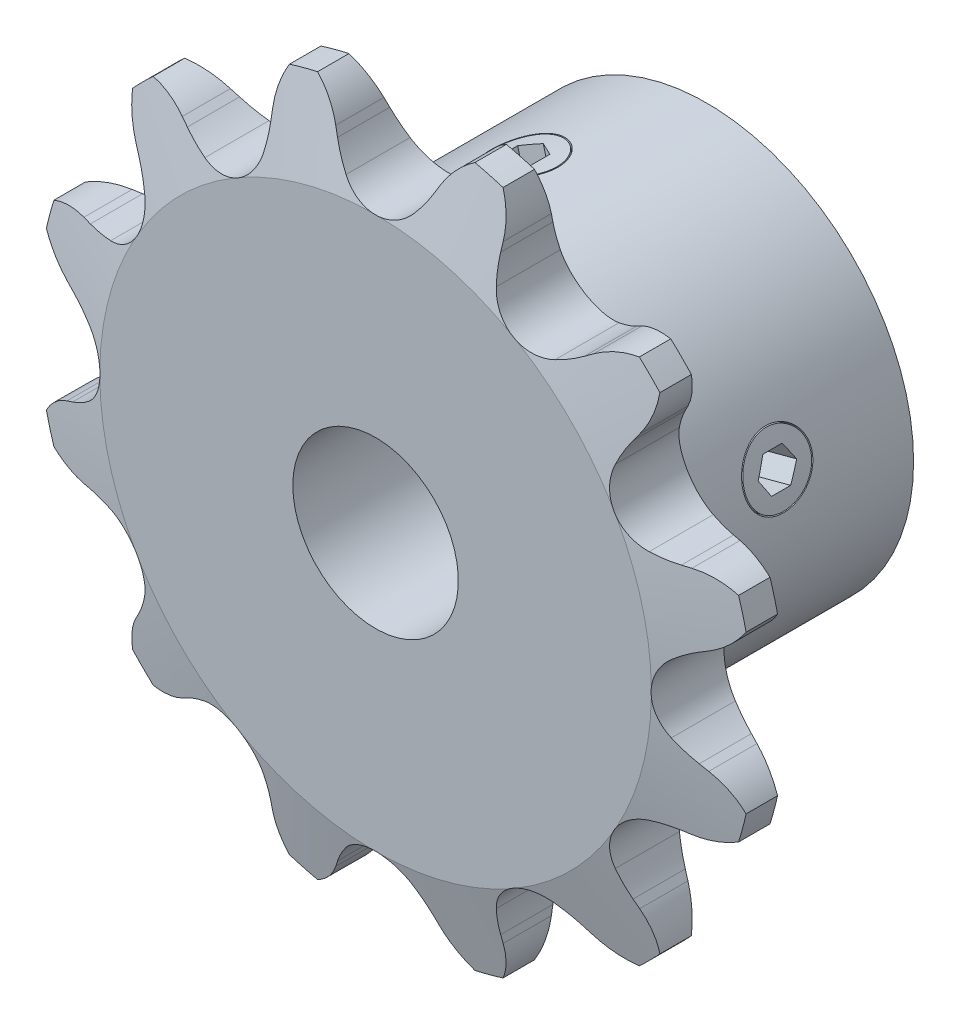
from build123d import *

# Parameters (mm, degrees)
TOOTH_CUT_NUMBER_OF_TEETH_12_DEPTH = 20.501564491
TOOTH_PATTERN_12_12_COUNT          = 12
SKETCH3_W                          = 9.906
SKETCH3_H                          = 7.9375
SKETCH4_R                          = 3.175
CUT_EXTRUDE1_DEPTH                 = 23.835008679
SKETCH7_R                          = 1.23825
CUT_EXTRUDE5_DEPTH                 = 25.456435746
CUT_EXTRUDE5_TAPER                 = -1
CUT_EXTRUDE5_OTHER_WAY_DEPTH       = 5.08
CUT_EXTRUDE5_OTHER_WAY_TAPER       = 1
EXTRUDE1_START                     = -5.08
EXTRUDE1_OUTLINE_R                 = 1.278474735
EXTRUDE1_DEPTH                     = 9.950685534
EXTRUDE1_START_2                   = -9
EXTRUDE1_2_DEPTH                   = 5
CUT_EXTRUDE6_START                 = 0.635
CUT_EXTRUDE6_DEPTH                 = 24.821435793
CIRPATTERN6_COUNT                  = 2
CIRPATTERN6_ANGLE                  = 90
SKETCH10_R                         = 3.175
CUT_EXTRUDE7_DEPTH                 = 23.835008679


with BuildPart() as part:
    # Sprocket-BaseSketch → 25 (04C) ANSI (ISO) Chain Number, 0.966in P.D. (revolve)
    with BuildSketch(Plane(origin=(0, 0, 0), x_dir=(0, 0, -1), z_dir=(1, 0, 0)), mode=Mode.PRIVATE) as f_25_04c_ansi_iso_chain_number_0_966i_sk:
        Polygon((1.397, 0), (1.397, 10.579261314), (0.60325, 13.754261314), (-0.60325, 13.754261314), (-1.397, 10.579261314), (-1.397, 0), align=None)
    revolve(f_25_04c_ansi_iso_chain_number_0_966i_sk.sketch.rotate(Axis((0, 0, -5.588), (0, 0, 1)), 90), axis=Axis((0, 0, -5.588), (0, 0, 1)))

    # Tooth-Sketch → Tooth-Cut, Number of teeth: 12 (cut, symmetric)
    with BuildSketch(Plane.XY):
        with BuildLine():
            Line((1.853848812, 12.017926297), (1.999985234, 12.308907838))
            ThreePointArc((1.999985234, 12.308907838), (3.017010036, 13.41879565), (4.46528191, 13.829525469))
            ThreePointArc((4.46528191, 13.829525469), (0, 14.532533063), (-4.46528191, 13.829525469))
            ThreePointArc((-4.46528191, 13.829525469), (-3.017010036, 13.41879565), (-1.999985234, 12.308907838))
            Line((-1.999985234, 12.308907838), (-1.853848812, 12.017926297))
            ThreePointArc((-1.853848812, 12.017926297), (-1.601561016, 11.580951016), (-1.300249366, 11.176219231))
            ThreePointArc((-1.300249366, 11.176219231), (0, 10.569902994), (1.300249366, 11.176219231))
            ThreePointArc((1.300249366, 11.176219231), (1.601561016, 11.580951016), (1.853848812, 12.017926297))
        make_face()
    tooth_cut_number_of_teeth_12 = extrude(amount=TOOTH_CUT_NUMBER_OF_TEETH_12_DEPTH, both=True, mode=Mode.SUBTRACT)

    # Tooth Pattern, 12 / 12: Tooth-Cut, Number of teeth: 12 ×12 about axis
    tooth_pattern_12_12_axis = Axis((0, 0, 0), (0, 0, 1))
    for i in range(1, TOOTH_PATTERN_12_12_COUNT):
        add(tooth_cut_number_of_teeth_12.rotate(tooth_pattern_12_12_axis, i * 360 / TOOTH_PATTERN_12_12_COUNT), mode=Mode.SUBTRACT)

    # Sketch3 → Hub-Revolve1 (revolve)
    with BuildSketch(Plane(origin=(0, 0, 0), x_dir=(0, 0, -1), z_dir=(1, 0, 0)), mode=Mode.PRIVATE) as hub_revolve1_sk:
        with Locations((6.35, 3.96875)):
            Rectangle(SKETCH3_W, SKETCH3_H)
    revolve(hub_revolve1_sk.sketch.rotate(Axis((0, 0, 9.906), (0, 0, -1)), 90), axis=Axis((0, 0, 9.906), (0, 0, -1)))

    # Sketch4 → Cut-Extrude1 (cut, through all)
    with BuildSketch(Plane(origin=(0, 0, -11.303), x_dir=(-1, 0, 0), z_dir=(0, 0, -1))):
        Circle(SKETCH4_R)
    extrude(amount=-CUT_EXTRUDE1_DEPTH, mode=Mode.SUBTRACT)

    # Sketch7 → Cut-Extrude5 (cut)
    with BuildSketch(Plane(origin=(-0.79375, 2.962315329, 0), x_dir=(-0.9659258262890682, -0.25881904510252124, 0), z_dir=(-0.25881904510252124, 0.9659258262890682, 0))):
        with Locations((0, -6.35)):
            Circle(SKETCH7_R)
    cut_extrude5 = extrude(amount=CUT_EXTRUDE5_DEPTH, taper=CUT_EXTRUDE5_TAPER, mode=Mode.SUBTRACT)

    # Sketch7 → Cut-Extrude5 other way (cut)
    with BuildSketch(Plane(origin=(-0.79375, 2.962315329, 0), x_dir=(-0.9659258262890682, -0.25881904510252124, 0), z_dir=(-0.25881904510252124, 0.9659258262890682, 0))):
        with Locations((0, -6.35)):
            Circle(SKETCH7_R)
    extrude(amount=-CUT_EXTRUDE5_OTHER_WAY_DEPTH, taper=CUT_EXTRUDE5_OTHER_WAY_TAPER, mode=Mode.SUBTRACT)

    # Extrude1: read off the stored shape, not the designer's step
    # Extrude1 outline → Extrude1 (add)
    with BuildSketch(Plane(origin=(-0.79375, 2.962315329, 0), x_dir=(-0.9659258262890682, -0.25881904510252124, 0), z_dir=(-0.25881904510252124, 0.9659258262890682, 0)).offset(EXTRUDE1_START)):
        with Locations((0, -6.35)):
            Circle(EXTRUDE1_OUTLINE_R)
    extrude1 = extrude(amount=EXTRUDE1_DEPTH)

    # Extrude1 2 outline → Extrude1 2 (cut)
    with BuildSketch(Plane.XY.offset(EXTRUDE1_START_2)):
        with BuildLine():
            ThreePointArc((-2.054376112, 7.667036262), (-1.428177703, 7.807958421), (-0.792640418, 7.89782422))
            Line((-0.792640418, 7.89782422), (0, 7.977375095))
            Line((0, 7.977375095), (0, 8.217504716))
            Line((0, 8.217504716), (-0.819464414, 7.997929888))
            Line((-0.819464414, 7.997929888), (-2.054376112, 7.667036262))
        make_face()
        with BuildLine():
            ThreePointArc((-3.262462798, 7.236037779), (-2.667139652, 7.47597969), (-2.054376112, 7.667036262))
            Line((-2.054376112, 7.667036262), (-3.289287944, 7.336142667))
            Line((-3.289287944, 7.336142667), (-5, 6.877758753))
            Line((-5, 6.877758753), (-5, 6.452646278))
            Line((-5, 6.452646278), (-3.262462798, 7.236037779))
        make_face()
    extrude1_2 = extrude(amount=EXTRUDE1_2_DEPTH, mode=Mode.SUBTRACT)

    # Sketch9 → Cut-Extrude6 (cut, through all)
    with BuildSketch(Plane(origin=(-0.79375, 2.962315329, 0), x_dir=(-0.9659258262890682, -0.25881904510252124, 0), z_dir=(-0.25881904510252124, 0.9659258262890682, 0)).offset(CUT_EXTRUDE6_START)):
        Polygon((0, -5.611872267), (-0.639237368, -5.980936134), (-0.639237368, -6.719063866), (0, -7.088127733), (0.639237368, -6.719063866), (0.639237368, -5.980936134), align=None)
    cut_extrude6 = extrude(amount=CUT_EXTRUDE6_DEPTH, mode=Mode.SUBTRACT)

    # CirPattern6: Cut-Extrude5, Extrude1, Extrude1 2, Cut-Extrude6 ×2 about axis
    cirpattern6_axis = Axis((0, 0, 0), (0, 0, -1))
    add([cut_extrude5.rotate(cirpattern6_axis, i * CIRPATTERN6_ANGLE / (CIRPATTERN6_COUNT - 1)) for i in range(1, CIRPATTERN6_COUNT)], mode=Mode.SUBTRACT)
    add([extrude1.rotate(cirpattern6_axis, i * CIRPATTERN6_ANGLE / (CIRPATTERN6_COUNT - 1)) for i in range(1, CIRPATTERN6_COUNT)])
    add([extrude1_2.rotate(cirpattern6_axis, i * CIRPATTERN6_ANGLE / (CIRPATTERN6_COUNT - 1)) for i in range(1, CIRPATTERN6_COUNT)], mode=Mode.SUBTRACT)
    add([cut_extrude6.rotate(cirpattern6_axis, i * CIRPATTERN6_ANGLE / (CIRPATTERN6_COUNT - 1)) for i in range(1, CIRPATTERN6_COUNT)], mode=Mode.SUBTRACT)

    # Sketch10 → Cut-Extrude7 (cut, through all)
    with BuildSketch(Plane(origin=(0, 0, -11.303), x_dir=(-1, 0, 0), z_dir=(0, 0, -1))):
        Circle(SKETCH10_R)
    extrude(amount=-CUT_EXTRUDE7_DEPTH, mode=Mode.SUBTRACT)


solid = part.part
